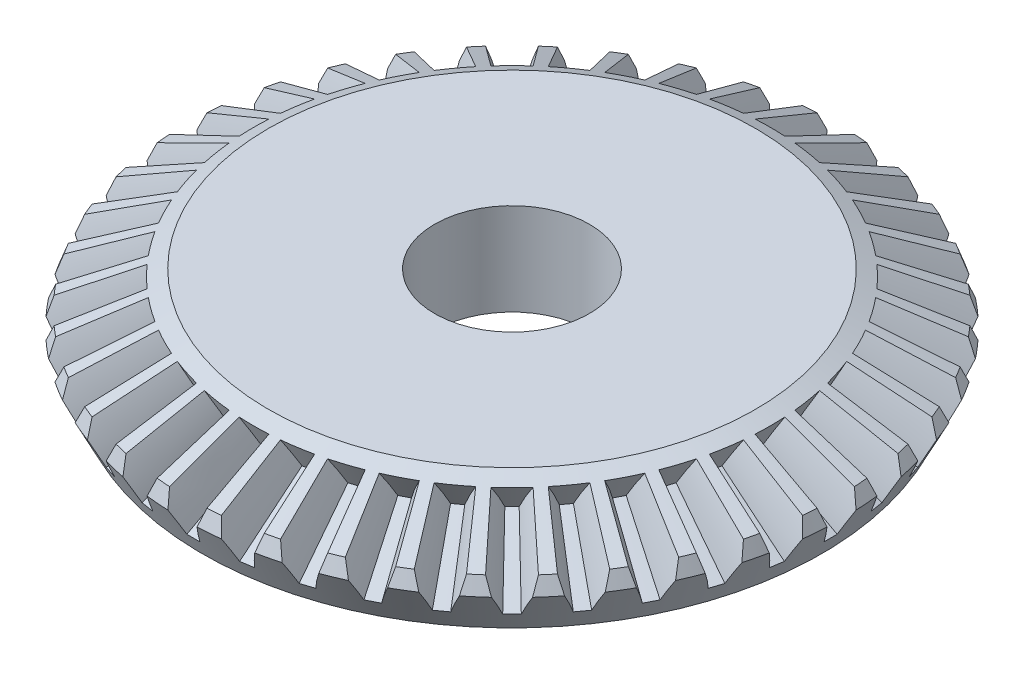
from build123d import *
from build123d.topology import SkipClean

# Parameters (mm, degrees)
CIRPATTERN1_COUNT = 40


with BuildPart() as part:
    # Section Profile → Revolve1 (revolve)
    with BuildSketch(Plane.XY):
        Polygon((-23.980096834, -15.539806331), (-6, -15.539806331), (-6, -11.106995428), (-18.929281359, -11.106995428), (-20.024184525, -8.917189097), (-25.128638874, -11.190309613), (-25.557068461, -12.385863078), align=None)
    revolve(axis=Axis((0, 0, 0), (0, -1, 0)))

    # Tooth Profile → Cut-Loft1 section 0
    with BuildSketch(Plane(origin=(-25.4, -12.7, 0), x_dir=(-0.4472135954999575, 0.8944271909999162, 0), z_dir=(0.8944271909999161, 0.44721359549995743, 0)), mode=Mode.PRIVATE) as cut_loft1_s0:
        with BuildLine():
            ThreePointArc((-1.5875, 0), (-1.588088492, -0.254910334), (-1.589853954, -0.509815233))
            add(Edge.make_bspline(
                [(-1.589853954, -0.509815233), (-1.386006516, -0.561234809), (-0.98943394, -0.669725406), (-0.404957144, -0.851522628), (0.335616218, -1.118690106), (0.870600267, -1.334644491), (1.216032405, -1.483189595), (1.37624682, -1.55401227)],
                knots=[0.063462601, 0.063462601, 0.063462601, 0.063462601, 0.063462601, 0.092110525, 0.119476175, 0.146842495, 0.17071236, 0.17071236, 0.17071236, 0.17071236, 0.17071236], degree=4))
            ThreePointArc((1.37624682, -1.55401227), (1.397, 0), (1.37624682, 1.55401227))
            add(Edge.make_bspline(
                [(-1.589853954, 0.509815233), (-1.386006516, 0.561234809), (-0.98943394, 0.669725406), (-0.404957144, 0.851522628), (0.335616218, 1.118690106), (0.870600267, 1.334644491), (1.216032405, 1.483189595), (1.37624682, 1.55401227)],
                knots=[0.063462601, 0.063462601, 0.063462601, 0.063462601, 0.063462601, 0.092110525, 0.119476175, 0.146842495, 0.17071236, 0.17071236, 0.17071236, 0.17071236, 0.17071236], degree=4))
            ThreePointArc((-1.589853954, 0.509815233), (-1.588088492, 0.254910334), (-1.5875, 0))
        make_face()
    cut_loft1 = loft([Vertex(0, 0, 0), cut_loft1_s0.sketch], mode=Mode.SUBTRACT)

    # CirPattern1: Cut-Loft1 ×40 about axis
    cirpattern1_axis = Axis((0, 0, 0), (0, -1, 0))
    for i in range(1, CIRPATTERN1_COUNT):
        add(cut_loft1.rotate(cirpattern1_axis, i * 360 / CIRPATTERN1_COUNT), mode=Mode.SUBTRACT)

    # Section Profile<5> → Revolve2 (revolve)
    with SkipClean():  # the faces are left unmerged after this step: merging them gives an invalid solid
        with BuildSketch(Plane.XY):
            Polygon((-18.929281359, -11.106995428), (-6, -11.106995428), (-6, -8.400544217), (-18.864021576, -8.400544217), (-20.024184525, -8.917189097), align=None)
        revolve(axis=Axis((0, 0, 0), (0, -1, 0)))


solid = part.part
